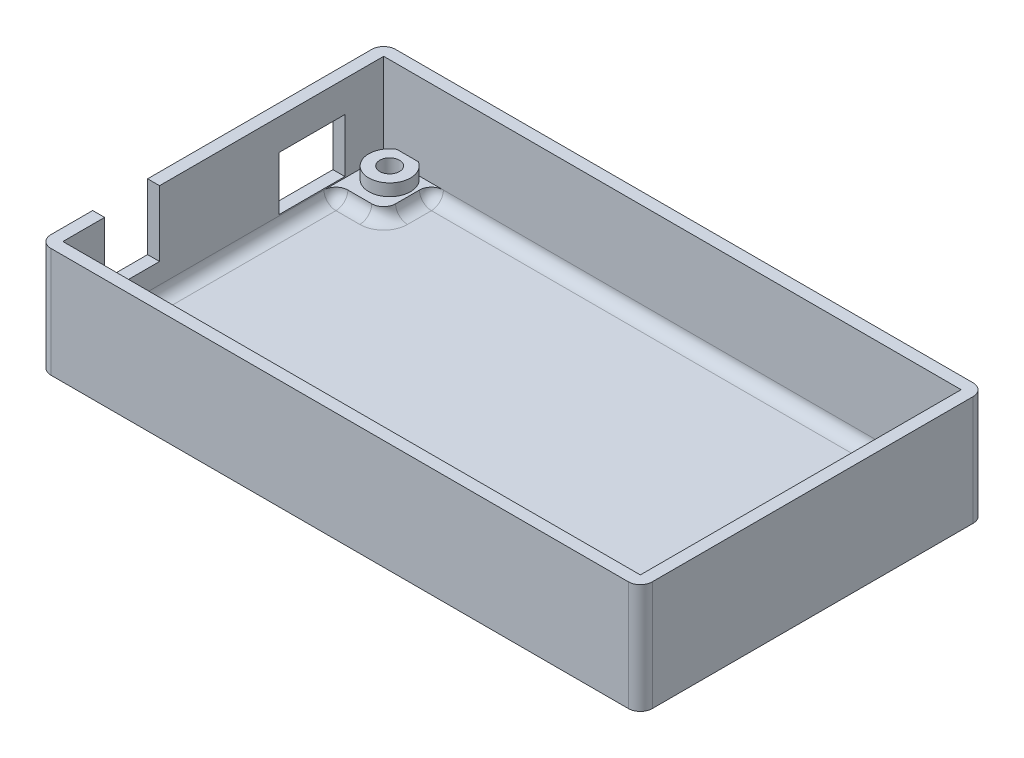
from build123d import *

# Parameters (mm, degrees)
SKETCH1_W           = 100.75
SKETCH1_H           = 57.75
SKETCH1_W_2         = 96.75
SKETCH1_H_2         = 53.75
SKETCH1_R           = 1.65
BOSS_EXTRUDE1_DEPTH = 2
SKETCH2_R           = 3.5
SKETCH2_R_2         = 1.65
BOSS_EXTRUDE2_DEPTH = 4
SKETCH3_W           = 100.75
SKETCH3_H           = 57.75
SKETCH3_W_2         = 96.75
SKETCH3_H_2         = 53.75
BOSS_EXTRUDE3_DEPTH = 16.4
FILLET1_R           = 2
SKETCH5_W           = 8
SKETCH5_H           = 8
SKETCH5_R           = 1.65
BOSS_EXTRUDE4_DEPTH = 2
FILLET3_R           = 2
FILLET4_R           = 2
SKETCH6_W           = 9.2
SKETCH6_H           = 11
SKETCH6_W_2         = 8
SKETCH6_H_2         = 2.6
CUT_EXTRUDE2_DEPTH  = 2
CUT_EXTRUDE3_DEPTH  = 2


with BuildPart() as part:
    # Sketch1 → Boss-Extrude1 (new body)
    # profile 1 of 2: a face of its own
    with BuildSketch(Plane(origin=(0, 0, 0), x_dir=(1, 0, 0), z_dir=(0, 1, 0))):
        with Locations((0.125, -0.125)):
            Rectangle(SKETCH1_W, SKETCH1_H)
        with Locations((0.125, -0.125)):
            Rectangle(SKETCH1_W_2, SKETCH1_H_2, mode=Mode.SUBTRACT)
    # profile 2 of 2: a face of its own
    with BuildSketch(Plane(origin=(0, 0, 0), x_dir=(1, 0, 0), z_dir=(0, 1, 0))):
        with Locations((0.125, -0.125)):
            Rectangle(SKETCH1_W_2, SKETCH1_H_2)
        with Locations(Location((-44.25, -24, 0), (0, 0, 270))):
            Circle(SKETCH1_R, mode=Mode.SUBTRACT)
        with Locations(Location((-44.25, 23.75, 0), (0, 0, 270))):
            Circle(SKETCH1_R, mode=Mode.SUBTRACT)
        with Locations(Location((44.5, 14, 0), (0, 0, 270))):
            Circle(SKETCH1_R, mode=Mode.SUBTRACT)
        with Locations(Location((44.5, -14.25, 0), (0, 0, 270))):
            Circle(SKETCH1_R, mode=Mode.SUBTRACT)
    extrude(amount=BOSS_EXTRUDE1_DEPTH)

    # Sketch2 → Boss-Extrude2 (add)
    # profile 1 of 4: a face of its own
    with BuildSketch(Plane(origin=(0, 2, 0), x_dir=(1, 0, 0), z_dir=(0, 1, 0))):
        with Locations(Location((44.5, 14, 0), (0, 0, 270))):
            Circle(SKETCH2_R)
        with Locations(Location((44.5, 14, 0), (0, 0, 270))):
            Circle(SKETCH2_R_2, mode=Mode.SUBTRACT)
    # profile 2 of 4: a face of its own
    with BuildSketch(Plane(origin=(0, 2, 0), x_dir=(1, 0, 0), z_dir=(0, 1, 0))):
        with Locations(Location((44.5, -14.25, 0), (0, 0, 270))):
            Circle(SKETCH2_R)
        with Locations(Location((44.5, -14.25, 0), (0, 0, 270))):
            Circle(SKETCH2_R_2, mode=Mode.SUBTRACT)
    # profile 3 of 4: a face of its own
    with BuildSketch(Plane(origin=(0, 2, 0), x_dir=(1, 0, 0), z_dir=(0, 1, 0))):
        with BuildLine():
            Line((-44.303434376, -20.500407914), (-40.787920243, -23.486187041))
            ThreePointArc((-40.787920243, -23.486187041), (-41.085130973, -25.494524687), (-42.447224362, -27))
            Line((-42.447224362, -27), (-46.052775638, -27))
            ThreePointArc((-46.052775638, -27), (-47.629726797, -23.090358985), (-44.303434376, -20.500407914))
        make_face()
        with Locations(Location((-44.25, -24, 0), (0, 0, 270))):
            Circle(SKETCH2_R_2, mode=Mode.SUBTRACT)
    # profile 4 of 4: a face of its own
    with BuildSketch(Plane(origin=(0, 2, 0), x_dir=(1, 0, 0), z_dir=(0, 1, 0))):
        with BuildLine():
            Line((-46.052775638, 26.75), (-42.447224362, 26.75))
            ThreePointArc((-42.447224362, 26.75), (-44.25, 20.25), (-46.052775638, 26.75))
        make_face()
        with Locations(Location((-44.25, 23.75, 0), (0, 0, 270))):
            Circle(SKETCH2_R_2, mode=Mode.SUBTRACT)
    extrude(amount=BOSS_EXTRUDE2_DEPTH)

    # Sketch3 → Boss-Extrude3 (add)
    with BuildSketch(Plane(origin=(0, 2, 0), x_dir=(1, 0, 0), z_dir=(0, 1, 0))):
        with Locations((0.125, -0.125)):
            Rectangle(SKETCH3_W, SKETCH3_H)
        with Locations((0.125, -0.125)):
            Rectangle(SKETCH3_W_2, SKETCH3_H_2, mode=Mode.SUBTRACT)
    extrude(amount=BOSS_EXTRUDE3_DEPTH)

    # Fillet1
    fillet1_edges = [part.edges().sort_by_distance(p)[0] for p in [
        (50.5, 9.2, 29),
        (-50.25, 9.2, 29),
        (-50.25, 9.2, -28.75),
        (50.5, 9.2, -28.75),
    ]]
    fillet(fillet1_edges, radius=FILLET1_R)

    # Sketch5 → Boss-Extrude4 (add)
    # profile 1 of 4: a face of its own
    with BuildSketch(Plane(origin=(0, 2, 0), x_dir=(1, 0, 0), z_dir=(0, 1, 0))):
        with Locations((44.5, 14)):
            Rectangle(SKETCH5_W, SKETCH5_H)
        with Locations(Location((44.5, 14, 0), (0, 0, 270))):
            Circle(SKETCH5_R, mode=Mode.SUBTRACT)
    # profile 2 of 4: a face of its own
    with BuildSketch(Plane(origin=(0, 2, 0), x_dir=(1, 0, 0), z_dir=(0, 1, 0))):
        with Locations((44.5, -14.25)):
            Rectangle(SKETCH5_W, SKETCH5_H)
        with Locations(Location((44.5, -14.25, 0), (0, 0, 270))):
            Circle(SKETCH5_R, mode=Mode.SUBTRACT)
    # profile 3 of 4: a face of its own
    with BuildSketch(Plane(origin=(0, 2, 0), x_dir=(1, 0, 0), z_dir=(0, 1, 0))):
        with Locations((-44.25, -23)):
            Rectangle(SKETCH5_W, SKETCH5_H)
        with Locations(Location((-44.25, -24, 0), (0, 0, 270))):
            Circle(SKETCH5_R, mode=Mode.SUBTRACT)
    # profile 4 of 4: a face of its own
    with BuildSketch(Plane(origin=(0, 2, 0), x_dir=(1, 0, 0), z_dir=(0, 1, 0))):
        with Locations((-44.25, 22.75)):
            Rectangle(SKETCH5_W, SKETCH5_H)
        with Locations(Location((-44.25, 23.75, 0), (0, 0, 270))):
            Circle(SKETCH5_R, mode=Mode.SUBTRACT)
    extrude(amount=BOSS_EXTRUDE4_DEPTH)

    # Fillet3
    fillet3_edges = [part.edges().sort_by_distance(p)[0] for p in [
        (40.5, 3, -18),
        (40.5, 3, -10),
        (48.5, 3, -10),
        (48.5, 3, -18),
        (40.5, 3, 10.25),
        (40.5, 3, 18.25),
        (48.5, 3, 18.25),
        (48.5, 3, 10.25),
        (-48.25, 3, 19),
        (-40.25, 3, 27),
        (-40.25, 3, 19),
        (-40.25, 3, -26.75),
        (-48.25, 3, -18.75),
        (-40.25, 3, -18.75),
    ]]
    fillet(fillet3_edges, radius=FILLET3_R)

    # Fillet4
    fillet4_edges = [part.edges().sort_by_distance(p)[0] for p in [
        (48.5, 2, -23.375),
        (47.914213562, 2, -18.585786438),
        (44.5, 2, -18),
        (41.085786438, 2, -17.414213562),
        (48.5, 2, 23.625),
        (47.914213562, 2, 18.835786438),
        (44.5, 2, 18.25),
        (41.085786438, 2, 17.664213562),
        (40.5, 2, 14.25),
        (41.085786438, 2, 10.835786438),
        (44.5, 2, 10.25),
        (47.914213562, 2, 9.664213562),
        (48.5, 2, 0.125),
        (47.914213562, 2, -9.414213562),
        (44.5, 2, -10),
        (41.085786438, 2, -10.585786438),
        (5.125, 2, 27),
        (-39.664213562, 2, 26.414213562),
        (-40.25, 2, 23),
        (-40.835786438, 2, 19.585786438),
        (5.125, 2, -26.75),
        (-39.664213562, 2, -26.164213562),
        (-40.25, 2, -22.75),
        (-40.835786438, 2, -19.335786438),
        (-44.25, 2, -18.75),
        (-47.664213562, 2, -18.164213562),
        (-48.25, 2, 0.125),
        (-47.664213562, 2, 18.414213562),
        (40.5, 2, -14),
        (-44.25, 2, 19),
    ]]
    fillet(fillet4_edges, radius=FILLET4_R - 0.0001)  # a hair under: the kernel refuses the full size

    # Sketch6 → Cut-Extrude2 (cut)
    with BuildSketch(Plane.ZY.offset(50.25)):
        with Locations((15.4, 12.9)):
            Rectangle(SKETCH6_W, SKETCH6_H)
        Polygon((-18.75, 7.4), (-20.25, 7.4), (-20.25, 4.2), (-9.25, 4.2), (-9.25, 7.4), (-10.75, 7.4), align=None)
        Polygon((-20.25, 13.2), (-20.25, 7.4), (-18.75, 7.4), (-18.75, 10), (-10.75, 10), (-10.75, 7.4), (-9.25, 7.4), (-9.25, 13.2), align=None)
        with Locations((-14.75, 8.7)):
            Rectangle(SKETCH6_W_2, SKETCH6_H_2)
    extrude(amount=-CUT_EXTRUDE2_DEPTH, mode=Mode.SUBTRACT)

    # Sketch4 → Cut-Extrude3 (cut)
    with BuildSketch(Plane.XZ):
        Polygon((40.5, -11.690598923), (40.5, -16.309401077), (44.5, -18.618802154), (48.5, -16.309401077), (48.5, -11.690598923), (44.5, -9.381197846), align=None)
        Polygon((40.355047504, 11.886928072), (44.355047504, 9.577526995), (48.355047504, 11.886928072), (48.355047504, 16.505730226), (44.355047504, 18.815131302), (40.355047504, 16.505730226), align=None)
        Polygon((-48.25, 26.309401077), (-48.25, 21.690598923), (-44.25, 19.381197846), (-40.25, 21.690598923), (-40.25, 26.309401077), (-44.25, 28.618802154), align=None)
        Polygon((-44.25, -19.131197846), (-48.25, -21.440598923), (-48.25, -26.059401077), (-44.25, -28.368802154), (-40.25, -26.059401077), (-40.25, -21.440598923), align=None)
    extrude(amount=-CUT_EXTRUDE3_DEPTH, mode=Mode.SUBTRACT)


solid = part.part
